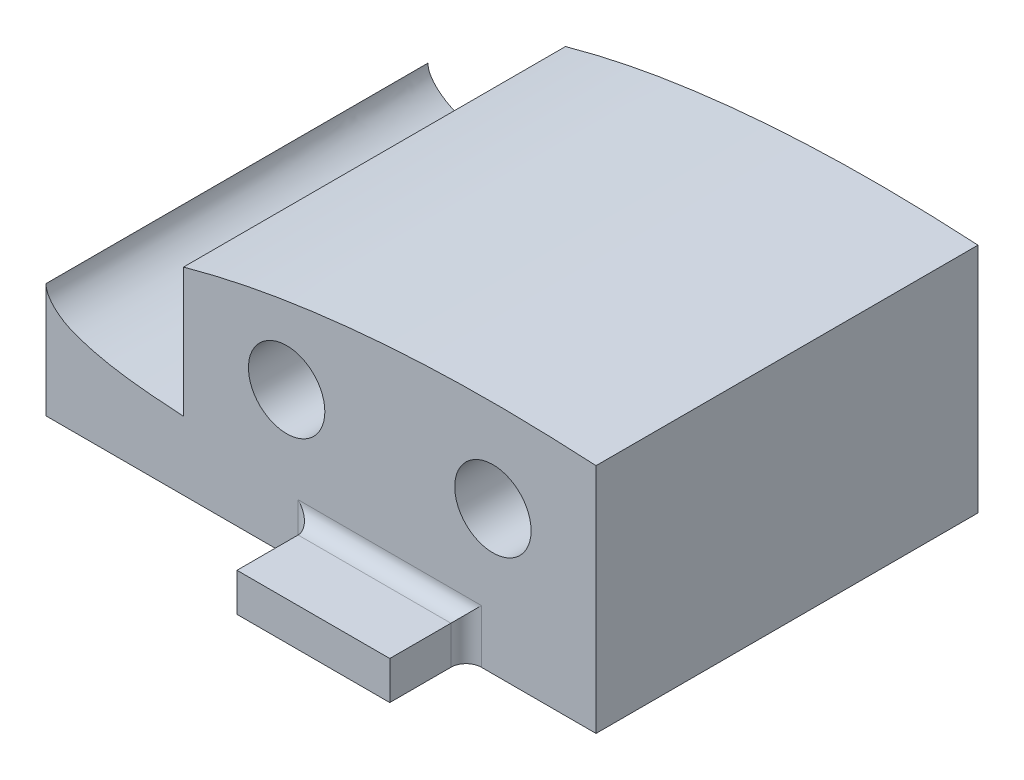
from build123d import *

# Parameters (mm, degrees)
BOSS_EXTRUDE2_DEPTH      = 31.75
BOSS_EXTRUDE2_DEPTH_BACK = 31.75
SKETCH6_R                = 6.35
SKETCH7_R                = 3.175
SKETCH7_W                = 25.4
SKETCH7_H                = 12.7
BOSS_EXTRUDE3_DEPTH      = 6.35
FILLET2_R                = 2.54


with BuildPart() as part:
    # Sketch6 → Boss-Extrude2 (new, two sides: drawn at the far end of the back side and taken through both)
    with BuildSketch(Plane.XY.offset(-BOSS_EXTRUDE2_DEPTH_BACK)):
        with BuildLine():
            Line((0, 0), (0, -19.05))
            Line((0, -19.05), (91.44, -19.05))
            Line((91.44, -19.05), (91.44, 19.508873689))
            add(Edge.make_bspline(
                [(91.44, 19.508873689), (84.035620806, 19.934056268), (72.792017375, 20.223197155), (57.72640102, 19.576586177), (46.241137994, 18.487194162), (34.713862172, 16.738987134), (26.950784486, 14.94277721), (23.006436851, 13.850652949), (22.86, 13.80984362)],
                knots=[0.299041321, 0.299041321, 0.299041321, 0.299041321, 0.346600594, 0.371102737, 0.395726297, 0.420570145, 0.445825119, 0.446799337, 0.446799337, 0.446799337, 0.446799337], degree=3))
            Line((22.86, 13.80984362), (22.86, -7.674303273))
            add(Edge.make_bspline(
                [(0, 0), (0, -0.17867716), (0.134938936, -1.688448649), (2.416021962, -3.935922156), (6.457030189, -5.50998662), (11.289417386, -6.62752917), (17.013896112, -7.281283102), (20.870897646, -7.562814069), (22.817971884, -7.671962522), (22.86, -7.674303273)],
                knots=[0.505625693, 0.505625693, 0.505625693, 0.505625693, 0.506863029, 0.51614777, 0.522766003, 0.535269014, 0.547551134, 0.559786371, 0.560056294, 0.560056294, 0.560056294, 0.560056294], degree=3))
        make_face()
        with Locations((40.005, 4.734594188)):
            Circle(SKETCH6_R, mode=Mode.SUBTRACT)
        with Locations((74.295, 4.734594188)):
            Circle(SKETCH6_R, mode=Mode.SUBTRACT)
    extrude(amount=BOSS_EXTRUDE2_DEPTH + BOSS_EXTRUDE2_DEPTH_BACK)

    # Sketch7 → Boss-Extrude3 (add)
    with BuildSketch(Plane.XZ.offset(19.05)):
        with Locations((57.15, 15.875)):
            Circle(SKETCH7_R)
        with Locations((57.15, -15.875)):
            Circle(SKETCH7_R)
        with Locations((57.15, 38.1)):
            Rectangle(SKETCH7_W, SKETCH7_H)
        with Locations((57.15, -38.1)):
            Rectangle(SKETCH7_W, SKETCH7_H)
    extrude(amount=-BOSS_EXTRUDE3_DEPTH)

    # Fillet2
    fillet2_edges = [part.edges().sort_by_distance(p)[0] for p in [
        (57.15, -12.7, 31.75),
        (44.45, -15.875, 31.75),
        (69.85, -15.875, 31.75),
        (57.15, -12.7, -31.75),
        (69.85, -15.875, -31.75),
        (44.45, -15.875, -31.75),
    ]]
    fillet(fillet2_edges, radius=FILLET2_R)


solid = part.part
